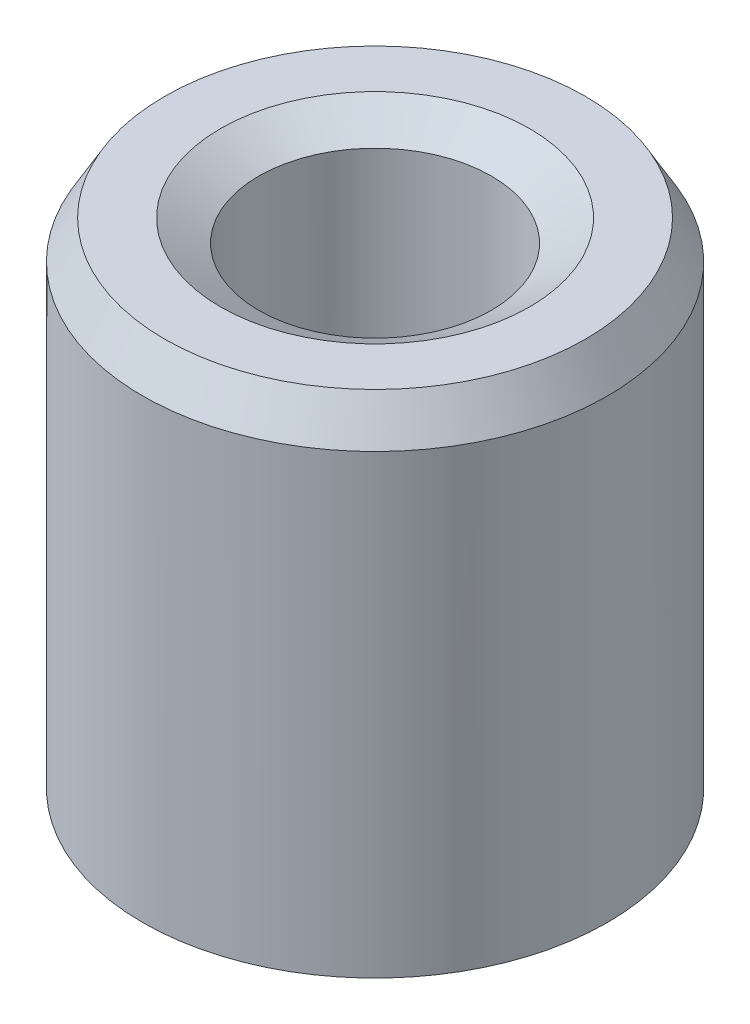
from build123d import *
from OCP.BRepFilletAPI import BRepFilletAPI_MakeChamfer

# Parameters (mm, degrees)
SKETCH1_R           = 12.5
BOSS_EXTRUDE1_DEPTH = 27.768917269
SKETCH2_R           = 6.258251105
CUT_EXTRUDE1_DEPTH  = 33.918274048
CHAMFER1_SIZE       = 2.053288604
CHAMFER1_SIZE2      = 1.185466728


with BuildPart() as part:
    # Sketch1 → Boss-Extrude1 (new body)
    with BuildSketch(Plane(origin=(0, 0, 0), x_dir=(1, 0, 0), z_dir=(0, 1, 0))):
        Circle(SKETCH1_R)
    extrude(amount=BOSS_EXTRUDE1_DEPTH)

    # Sketch2 → Cut-Extrude1 (cut, through all)
    with BuildSketch(Plane(origin=(0, 0, 0), x_dir=(1, 0, 0), z_dir=(0, 1, 0))):
        Circle(SKETCH2_R)
    extrude(amount=CUT_EXTRUDE1_DEPTH, mode=Mode.SUBTRACT)

    # Chamfer1: one chamfer whose edges measure the first distance from different faces: ONE call of the kernel's chamfer builder (chamfer() names one face for all edges)
    chamfer1_edges_1 = [part.edges().sort_by_distance(p)[0] for p in [
        (-6.258251105, 27.768917269, 0),
    ]]
    chamfer1_side_1 = [part.faces().sort_by_distance(p)[0] for p in [
        (-12.146446609, 27.768917269, 0),
    ]]
    chamfer1_edges_2 = [part.edges().sort_by_distance(p)[0] for p in [
        (-6.258251105, 0, 0),
    ]]
    chamfer1_side_2 = [part.faces().sort_by_distance(p)[0] for p in [
        (-6.258251105, 13.884458635, 0),
    ]]
    chamfer1_edges_3 = [part.edges().sort_by_distance(p)[0] for p in [
        (-12.5, 0, 0),
    ]]
    chamfer1_side_3 = [part.faces().sort_by_distance(p)[0] for p in [
        (-12.146446609, 0, 0),
    ]]
    chamfer1_edges_4 = [part.edges().sort_by_distance(p)[0] for p in [
        (-12.5, 27.768917269, 0),
    ]]
    chamfer1_side_4 = [part.faces().sort_by_distance(p)[0] for p in [
        (-12.5, 13.884458635, 0),
    ]]
    chamfer1 = BRepFilletAPI_MakeChamfer(part.part.solid().wrapped)
    for e in chamfer1_edges_1:
        chamfer1.Add(CHAMFER1_SIZE, CHAMFER1_SIZE2, e.wrapped, chamfer1_side_1[0].wrapped)  # the first distance lies on this face
    for e in chamfer1_edges_2:
        chamfer1.Add(CHAMFER1_SIZE, CHAMFER1_SIZE2, e.wrapped, chamfer1_side_2[0].wrapped)  # the first distance lies on this face
    for e in chamfer1_edges_3:
        chamfer1.Add(CHAMFER1_SIZE, CHAMFER1_SIZE2, e.wrapped, chamfer1_side_3[0].wrapped)  # the first distance lies on this face
    for e in chamfer1_edges_4:
        chamfer1.Add(CHAMFER1_SIZE, CHAMFER1_SIZE2, e.wrapped, chamfer1_side_4[0].wrapped)  # the first distance lies on this face
    add(Compound.cast(chamfer1.Shape()), mode=Mode.REPLACE)


solid = part.part
